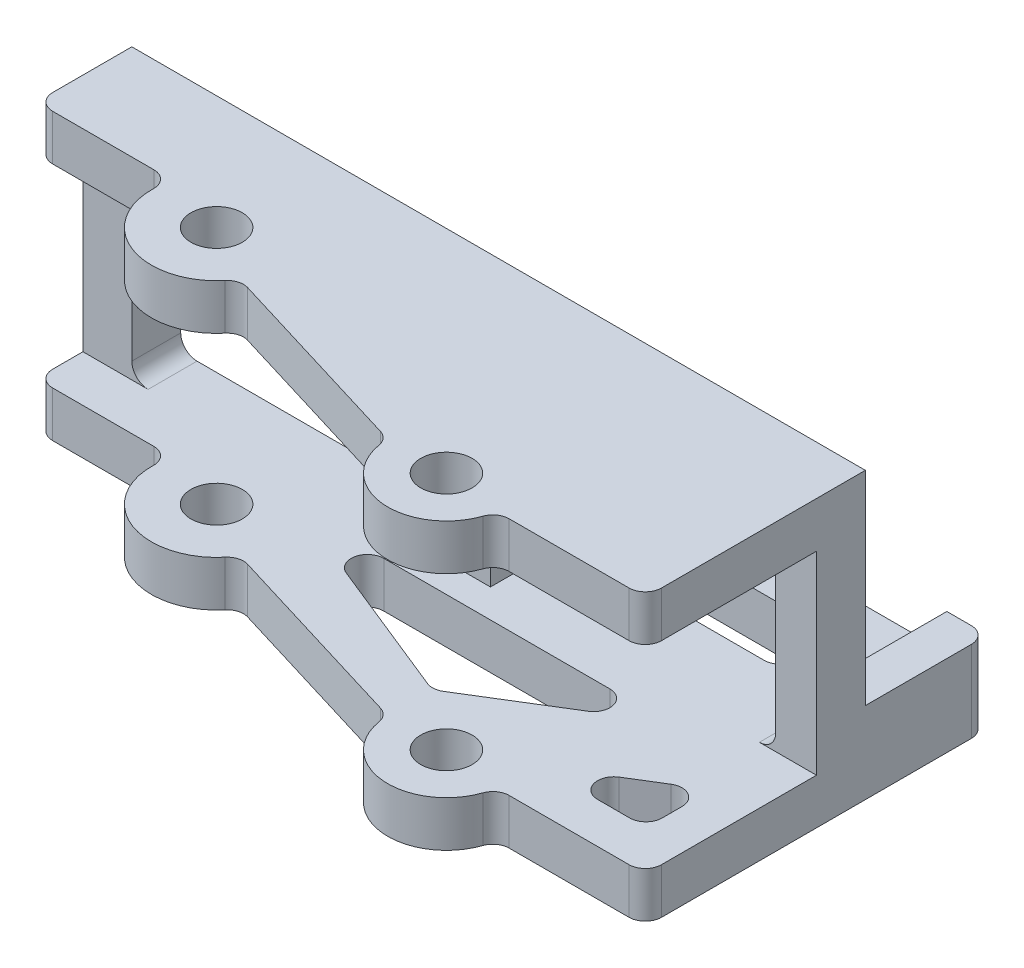
from build123d import *

# Parameters (mm, degrees)
SKETCH1_W                  = 114.3
SKETCH1_H                  = 44.45
BOSS_EXTRUDE1_DEPTH        = 31.115
SKETCH3_R                  = 4
PIVOT_POINTS_DEPTH         = 79.803986098
SKETCH4_W                  = 114.3
SKETCH4_H                  = 30.226
TOP_CUTOUT_DEPTH           = 35.56
SKETCH5_W                  = 114.3
SKETCH5_H                  = 31.75
BOTTOM_CUTOUT_DEPTH        = 19.05
SIDE_PROFILE_CUT_DEPTH     = 79.803986098
F_8_CLEARANCE_HOLE1_D      = 4.4958
OPTIMIZATION_CUTOUTS_DEPTH = 12.7
SKETCH12_W                 = 44.45
SKETCH12_H                 = 30.226
CUT_EXTRUDE7_DEPTH         = 71.380118364
FILLET2_R                  = 2.54


with BuildPart() as part:
    # Sketch1 → Boss-Extrude1 (new, symmetric)
    with BuildSketch(Plane.XY):
        Rectangle(SKETCH1_W, SKETCH1_H)
    extrude(amount=BOSS_EXTRUDE1_DEPTH, both=True)

    # Sketch3 → Pivot Points (cut, through all)
    with BuildSketch(Plane.XZ.offset(22.225)):
        with Locations((-26.162, 5.715)):
            Circle(SKETCH3_R)
        with Locations((24.892, 20.955)):
            Circle(SKETCH3_R)
    extrude(amount=-PIVOT_POINTS_DEPTH, mode=Mode.SUBTRACT)

    # Sketch4 → Top Cutout (cut)
    with BuildSketch(Plane.XY.offset(31.115)):
        Rectangle(SKETCH4_W, SKETCH4_H)
    extrude(amount=-TOP_CUTOUT_DEPTH, mode=Mode.SUBTRACT)

    # Sketch5 → Bottom Cutout (cut)
    with BuildSketch(Plane(origin=(0, 0, -31.115), x_dir=(-1, 0, 0), z_dir=(0, 0, -1))):
        with Locations((0, 6.35)):
            Rectangle(SKETCH5_W, SKETCH5_H)
    extrude(amount=-BOTTOM_CUTOUT_DEPTH, mode=Mode.SUBTRACT)

    # Sketch6 → Side Profile Cut (cut, through all)
    with BuildSketch(Plane.XZ.offset(22.225)):
        with BuildLine():
            ThreePointArc((-35.89593012, 2.803607822), (-30.223846998, 15.027733163), (-17.405875711, 10.868240479))
            Line((-17.405875711, 10.868240479), (15.748, 20.955))
            ThreePointArc((15.748, 20.955), (24.255455776, 30.076817113), (33.947376083, 22.225))
            Line((33.947376083, 22.225), (57.15, 22.225))
            Line((57.15, 22.225), (57.15, 31.115))
            Line((57.15, 31.115), (-57.15, 31.115))
            Line((-57.15, 31.115), (-57.15, 2.803607822))
            Line((-57.15, 2.803607822), (-35.89593012, 2.803607822))
        make_face()
        Polygon((-21.59, -12.065), (-57.15, -12.065), (-57.15, -31.115), (-4.826, -31.115), align=None)
    extrude(amount=-SIDE_PROFILE_CUT_DEPTH, mode=Mode.SUBTRACT)

    # #8 Clearance Hole1 (through all)
    with Locations(Plane(origin=(0, -22.225, 0), x_dir=(-1, 0, 0), z_dir=(0, -1, 0))):
        with Locations((2.54, 21.59), (-48.26, 21.59)):
            Hole(F_8_CLEARANCE_HOLE1_D / 2)

    # Sketch10 → optimization cutouts (cut)
    with BuildSketch(Plane.XZ.offset(22.225)):
        Polygon((34.395949285, 15.875), (50.905949285, 15.875), (50.905949285, 5.715), align=None)
        Polygon((2.54, -15.875), (43.18, -15.875), (35.356188013, -24.765), (10.3632, -24.765), align=None)
        Polygon((-18.894311293, 0), (38.383902049, 0), (15.682652049, 13.97), align=None)
    extrude(amount=-OPTIMIZATION_CUTOUTS_DEPTH, mode=Mode.SUBTRACT)

    # Sketch12 → Cut-Extrude7 (cut, through all)
    with BuildSketch(Plane.XY.offset(-4.445)):
        with Locations((28.575, 0)):
            Rectangle(SKETCH12_W, SKETCH12_H)
        with Locations((-27.305, 0)):
            Rectangle(SKETCH12_W, SKETCH12_H)
    extrude(amount=-CUT_EXTRUDE7_DEPTH, mode=Mode.SUBTRACT)

    # Fillet2
    # the kernel refuses this fillet: 2.54 mm, written as the material it adds along each edge
    with BuildSketch(Plane(origin=(33.947376083, 15.113, 22.225), x_dir=(1, 0, 0), z_dir=(0, 1, 0)), Plane(origin=(33.947376083, -22.225, 22.225), x_dir=(1, 0, 0), z_dir=(0, 1, 0))) as fillet2_piece_1:
        with BuildLine():
            CenterArc((1.989973889, -2.54), FILLET2_R, 90, 70.968559075)
            ThreePointArc((-0.411189148, -1.71173913), (-0.164304974, -0.865788037), (0, 0))
            Line((0, 0), (1.989973889, 0))
        make_face()
    extrude(amount=7.112)
    with BuildSketch(Plane(origin=(15.748, 15.113, 20.955), x_dir=(-0.9567024140899113, 0, -0.2910678458272846), z_dir=(0, 1, 0))) as fillet2_piece_2:
        with BuildLine():
            CenterArc((1.71422645, 2.54), FILLET2_R, 206.435081656, 63.564918344)
            ThreePointArc((-0.56018949, 1.40923383), (-0.250829923, 0.716250077), (0, 0))
            Line((0, 0), (1.71422645, 0))
        make_face()
    extrude(amount=7.112)
    with BuildSketch(Plane(origin=(15.748, -22.225, 20.955), x_dir=(0.08292286781363219, 0, 0.996555968319674), z_dir=(0, 1, 0))) as fillet2_piece_3:
        with BuildLine():
            CenterArc((1.727117491, -2.53125216), FILLET2_R, 94.756592224, 63.564918344)
            Line((-0.633231662, -1.592981476), (0, 0))
            ThreePointArc((0, 0), (0.758246703, -0.031492226), (1.516493407, 0))
        make_face()
    extrude(amount=7.112)
    with BuildSketch(Plane(origin=(-21.59, -22.225, -12.065), x_dir=(-1, 0, 0), z_dir=(0, 1, 0))) as fillet2_piece_4:
        with BuildLine():
            CenterArc((FILLET2_R * 0.452066064428, -FILLET2_R), FILLET2_R, 90, 48.65222278)
            Line((-FILLET2_R * 0.298647452495, -FILLET2_R * 0.339372105108), (0, 0))
            Line((0, 0), (FILLET2_R * 0.452066064428, 0))
        make_face()
    extrude(amount=7.112)
    with BuildSketch(Plane(origin=(-18.894311293, -22.225, 0), x_dir=(1, 0, 0), z_dir=(0, 1, 0))) as fillet2_piece_5:
        with BuildLine():
            CenterArc((FILLET2_R * 5.14455401597, -FILLET2_R), FILLET2_R, 90, 158)
            Line((FILLET2_R * 4.76994742255, -FILLET2_R * 1.92718385457), (0, 0))
            Line((0, 0), (FILLET2_R * 5.14455401597, 0))
        make_face()
    extrude(amount=7.112)
    with BuildSketch(Plane(origin=(38.383902049, -22.225, 0), x_dir=(-1, 0, 0), z_dir=(0, 1, 0))) as fillet2_piece_6:
        with BuildLine():
            CenterArc((FILLET2_R * 3.53304219031, FILLET2_R), FILLET2_R, 121.607502246, 148.392497754)
            Line((FILLET2_R * 3.00894476464, FILLET2_R * 1.8516583167), (0, 0))
            Line((0, 0), (FILLET2_R * 3.53304219031, 0))
        make_face()
    extrude(amount=7.112)
    with BuildSketch(Plane(origin=(15.682652049, -22.225, 13.97), x_dir=(0.8516583167045444, 0, -0.5240974256643338), z_dir=(0, 1, 0))) as fillet2_piece_7:
        with BuildLine():
            CenterArc((FILLET2_R * 0.50521852562, FILLET2_R), FILLET2_R, 216.392497754, 53.607502246)
            Line((-FILLET2_R * 0.299752966451, FILLET2_R * 0.40668651039), (0, 0))
            Line((0, 0), (FILLET2_R * 0.50521852562, 0))
        make_face()
    extrude(amount=7.112)
    with BuildSketch(Plane(origin=(35.356188013, -22.225, -24.765), x_dir=(-1, 0, 0), z_dir=(0, 1, 0))) as fillet2_piece_8:
        with BuildLine():
            CenterArc((FILLET2_R * 0.452042703087, FILLET2_R), FILLET2_R, 221.35, 48.65)
            Line((-FILLET2_R * 0.298645184321, FILLET2_R * 0.339342981798), (0, 0))
            Line((0, 0), (FILLET2_R * 0.452042703087, 0))
        make_face()
    extrude(amount=7.112)
    with BuildSketch(Plane(origin=(43.18, -22.225, -15.875), x_dir=(-0.6606570182018219, 0, -0.7506878874077278), z_dir=(0, 1, 0))) as fillet2_piece_9:
        with BuildLine():
            CenterArc((FILLET2_R * 2.2121803829, FILLET2_R), FILLET2_R, 138.65, 131.35)
            Line((FILLET2_R * 1.46149249549, FILLET2_R * 1.6606570182), (0, 0))
            Line((0, 0), (FILLET2_R * 2.2121803829, 0))
        make_face()
    extrude(amount=7.112)
    with BuildSketch(Plane(origin=(2.54, -22.225, -15.875), x_dir=(0.6606278948920252, 0, -0.7507135169227549), z_dir=(0, 1, 0))) as fillet2_piece_10_section:
        with BuildLine():
            CenterArc((FILLET2_R * 2.21206606443, -FILLET2_R), FILLET2_R, 90, 131.34777722)
            Line((FILLET2_R * 1.4613525475, -FILLET2_R * 1.66062789489), (0, 0))
            Line((0, 0), (FILLET2_R * 2.21206606443, 0))
        make_face()
    fillet2_piece_10 = extrude(amount=12.7, mode=Mode.PRIVATE)
    fillet2_piece_10 = split(fillet2_piece_10, bisect_by=Plane(origin=(4.780641992, -15.113, -17.020766016), z_dir=(0, -1, 0)), keep=Keep.TOP, mode=Mode.PRIVATE)
    fillet2_piece_10 = split(fillet2_piece_10, bisect_by=Plane(origin=(6.35, -18.669, -17.020766016), z_dir=(-1, 0, 0)), keep=Keep.TOP, mode=Mode.PRIVATE)
    add(fillet2_piece_10)
    with BuildSketch(Plane(origin=(2.54, -22.225, -15.875), x_dir=(0.6606278948920252, 0, -0.7507135169227549), z_dir=(0, 1, 0))) as fillet2_piece_11_section:
        with BuildLine():
            CenterArc((FILLET2_R * 2.21206606443, -FILLET2_R), FILLET2_R, 90, 131.34777722)
            Line((FILLET2_R * 1.4613525475, -FILLET2_R * 1.66062789489), (0, 0))
            Line((0, 0), (FILLET2_R * 2.21206606443, 0))
        make_face()
    fillet2_piece_11 = extrude(amount=12.7, mode=Mode.PRIVATE)
    fillet2_piece_11 = split(fillet2_piece_11, bisect_by=Plane(origin=(6.870553853, -15.113, -16.051154706), z_dir=(0, -1, 0)), keep=Keep.TOP, mode=Mode.PRIVATE)
    fillet2_piece_11 = split(fillet2_piece_11, bisect_by=Plane(origin=(6.35, -18.669, -16.051154706), z_dir=(1, 0, 0)), keep=Keep.TOP, mode=Mode.PRIVATE)
    add(fillet2_piece_11)
    with BuildSketch(Plane(origin=(2.54, -22.225, -15.875), x_dir=(0.6606278948920252, 0, -0.7507135169227549), z_dir=(0, 1, 0))) as fillet2_piece_12_section:
        with BuildLine():
            CenterArc((FILLET2_R * 2.21206606443, -FILLET2_R), FILLET2_R, 90, 131.34777722)
            Line((FILLET2_R * 1.4613525475, -FILLET2_R * 1.66062789489), (0, 0))
            Line((0, 0), (FILLET2_R * 2.21206606443, 0))
        make_face()
    fillet2_piece_12 = extrude(amount=12.7, mode=Mode.PRIVATE)
    fillet2_piece_12 = split(fillet2_piece_12, bisect_by=Plane(origin=(4.780641992, -15.113, -17.020766016), z_dir=(0, 1, 0)), keep=Keep.TOP, mode=Mode.PRIVATE)
    fillet2_piece_12 = split(fillet2_piece_12, bisect_by=Plane(origin=(6.35, -12.319, -17.020766016), z_dir=(-1, 0, 0)), keep=Keep.TOP, mode=Mode.PRIVATE)
    add(fillet2_piece_12)
    with BuildSketch(Plane(origin=(10.3632, -22.225, -24.765), x_dir=(-0.6606278948920246, 0, 0.7507135169227555), z_dir=(0, 1, 0))) as fillet2_piece_13:
        with BuildLine():
            CenterArc((FILLET2_R * 0.452066064428, FILLET2_R), FILLET2_R, 221.34777722, 48.65222278)
            Line((-FILLET2_R * 0.298647452495, FILLET2_R * 0.339372105108), (0, 0))
            Line((0, 0), (FILLET2_R * 0.452066064428, 0))
        make_face()
    extrude(amount=7.112)
    with BuildSketch(Plane(origin=(50.905949285, -22.225, 15.875), x_dir=(0, 0, -1), z_dir=(0, 1, 0))) as fillet2_piece_14:
        with BuildLine():
            CenterArc((FILLET2_R, FILLET2_R), FILLET2_R, 180, 90)
            Line((0, FILLET2_R), (0, 0))
            Line((0, 0), (FILLET2_R, 0))
        make_face()
    extrude(amount=7.112)
    with BuildSketch(Plane(origin=(34.395949285, -22.225, 15.875), x_dir=(0.851658316704544, 0, -0.5240974256643346), z_dir=(0, 1, 0))) as fillet2_piece_15:
        with BuildLine():
            CenterArc((FILLET2_R * 3.53304219031, -FILLET2_R), FILLET2_R, 90, 148.392497754)
            Line((FILLET2_R * 3.00894476464, -FILLET2_R * 1.8516583167), (0, 0))
            Line((0, 0), (FILLET2_R * 3.53304219031, 0))
        make_face()
    extrude(amount=7.112)
    with BuildSketch(Plane(origin=(50.905949285, -22.225, 5.715), x_dir=(-0.8516583167045437, 0, 0.5240974256643349), z_dir=(0, 1, 0))) as fillet2_piece_16:
        with BuildLine():
            CenterArc((FILLET2_R * 1.78956442481, FILLET2_R), FILLET2_R, 148.392497754, 121.607502246)
            Line((FILLET2_R * 0.937906108101, FILLET2_R * 1.52409742566), (0, 0))
            Line((0, 0), (FILLET2_R * 1.78956442481, 0))
        make_face()
    extrude(amount=7.112)
    with BuildSketch(Plane(origin=(-17.405875711, -22.225, 10.868240479), x_dir=(-0.5750066168116974, 0, 0.818148758248013), z_dir=(0, 1, 0)), Plane(origin=(-17.405875711, 15.113, 10.868240479), x_dir=(-0.5750066168116988, 0, 0.818148758248012), z_dir=(0, 1, 0))) as fillet2_piece_17:
        with BuildLine():
            CenterArc((1.842102236, 2.531739897), FILLET2_R, 198.178198368, 67.199787488)
            Line((-0.571128471, 1.739327406), (0, 0))
            ThreePointArc((0, 0), (0.818712105, 0.033040412), (1.63742421, 0))
        make_face()
    extrude(amount=7.112)
    with BuildSketch(Plane(origin=(-35.89593012, 15.113, 2.803607822), x_dir=(-1, 0, 0), z_dir=(0, 1, 0)), Plane(origin=(-35.89593012, -22.225, 2.803607822), x_dir=(-1, 0, 0), z_dir=(0, 1, 0))) as fillet2_piece_18:
        with BuildLine():
            CenterArc((2.960638319, 2.54), FILLET2_R, 178.324233192, 91.675766808)
            ThreePointArc((0.421724631, 2.614278436), (0.296399362, 1.293340734), (0, 0))
            Line((0, 0), (2.960638319, 0))
        make_face()
    extrude(amount=7.112)
    with BuildSketch(Plane(origin=(50.8, -15.113, -4.445), x_dir=(-1, 0, 0), z_dir=(0, 0, -1))) as fillet2_piece_19_section:
        with BuildLine():
            CenterArc((FILLET2_R, FILLET2_R), FILLET2_R, 180, 90)
            Line((0, FILLET2_R), (0, 0))
            Line((0, 0), (FILLET2_R, 0))
        make_face()
    fillet2_piece_19 = extrude(amount=26.67, mode=Mode.PRIVATE)
    fillet2_piece_19 = fillet2_piece_19 - Plane(origin=(48.26, -14.517421037, -21.59), x_dir=(1, 0, 0), z_dir=(0, 1, 0)) * Cylinder(2.2479, 64, mode=Mode.PRIVATE)
    add(fillet2_piece_19)
    with BuildSketch(Plane(origin=(-5.08, -15.113, -4.445), x_dir=(-1, 0, 0), z_dir=(0, 0, -1))) as fillet2_piece_20_section:
        with BuildLine():
            CenterArc((FILLET2_R, FILLET2_R), FILLET2_R, 180, 90)
            Line((0, FILLET2_R), (0, 0))
            Line((0, 0), (FILLET2_R, 0))
        make_face()
    fillet2_piece_20 = extrude(amount=32.731363636, mode=Mode.PRIVATE)
    fillet2_piece_20 = split(fillet2_piece_20, bisect_by=Plane(origin=(-12.025309715, -14.53013241, -22.933966233), z_dir=(0.7507135169227551, 0, 0.6606278948920249)), keep=Keep.TOP, mode=Mode.PRIVATE)
    add(fillet2_piece_20)
    with BuildSketch(Plane(origin=(50.8, 15.113, -4.445), x_dir=(-1, 0, 0), z_dir=(0, 0, -1)), Plane(origin=(-5.08, 15.113, -4.445), x_dir=(-1, 0, 0), z_dir=(0, 0, -1)), Plane(origin=(-49.53, -15.113, -4.445), x_dir=(1, 0, 0), z_dir=(0, 0, -1))) as fillet2_piece_21:
        with BuildLine():
            CenterArc((FILLET2_R, -FILLET2_R), FILLET2_R, 90, 90)
            Line((0, -FILLET2_R), (0, 0))
            Line((0, 0), (FILLET2_R, 0))
        make_face()
    extrude(amount=7.62)
    with BuildSketch(Plane(origin=(-49.53, 15.113, -4.445), x_dir=(1, 0, 0), z_dir=(0, 0, -1))) as fillet2_piece_22:
        with BuildLine():
            CenterArc((FILLET2_R, FILLET2_R), FILLET2_R, 180, 90)
            Line((0, FILLET2_R), (0, 0))
            Line((0, 0), (FILLET2_R, 0))
        make_face()
    extrude(amount=7.62)
    # the kernel refuses this fillet: 2.54 mm, written as the material it takes off along each edge
    with BuildSketch(Plane(origin=(57.15, 8.763, 22.225), x_dir=(0, 0, -1), z_dir=(0, 1, 0)), Plane(origin=(-57.15, 8.763, 2.803607822), x_dir=(1, 0, 0), z_dir=(0, 1, 0)), Plane(origin=(-57.15, -28.575, 2.803607822), x_dir=(1, 0, 0), z_dir=(0, 1, 0))) as fillet2_2_piece_1:
        with BuildLine():
            CenterArc((FILLET2_R, FILLET2_R), FILLET2_R, 180, 90)
            Line((0, FILLET2_R), (0, 0))
            Line((0, 0), (FILLET2_R, 0))
        make_face()
    extrude(amount=19.812, mode=Mode.SUBTRACT)
    with BuildSketch(Plane(origin=(57.15, -28.575, 22.225), x_dir=(-1, 0, 0), z_dir=(0, 1, 0))) as fillet2_2_piece_2:
        with BuildLine():
            CenterArc((FILLET2_R, -FILLET2_R), FILLET2_R, 90, 90)
            Line((0, -FILLET2_R), (0, 0))
            Line((0, 0), (FILLET2_R, 0))
        make_face()
    extrude(amount=19.812, mode=Mode.SUBTRACT)
    with BuildSketch(Plane(origin=(57.15, -28.575, -31.115), x_dir=(-1, 0, 0), z_dir=(0, 1, 0))) as fillet2_2_piece_3:
        with BuildLine():
            CenterArc((FILLET2_R, FILLET2_R), FILLET2_R, 180, 90)
            Line((0, FILLET2_R), (0, 0))
            Line((0, 0), (FILLET2_R, 0))
        make_face()
    extrude(amount=25.4, mode=Mode.SUBTRACT)
    with BuildSketch(Plane(origin=(-4.826, -25.095619509, -31.115), x_dir=(1, 0, 0), z_dir=(0, 1, 0))) as fillet2_2_piece_4:
        with BuildLine():
            CenterArc((FILLET2_R * 0.452066064428, -FILLET2_R), FILLET2_R, 90, 48.65222278)
            Line((-FILLET2_R * 0.298647452495, -FILLET2_R * 0.339372105108), (0, 0))
            Line((0, 0), (FILLET2_R * 0.452066064428, 0))
        make_face()
    extrude(amount=18.441239018, mode=Mode.SUBTRACT)


solid = part.part
